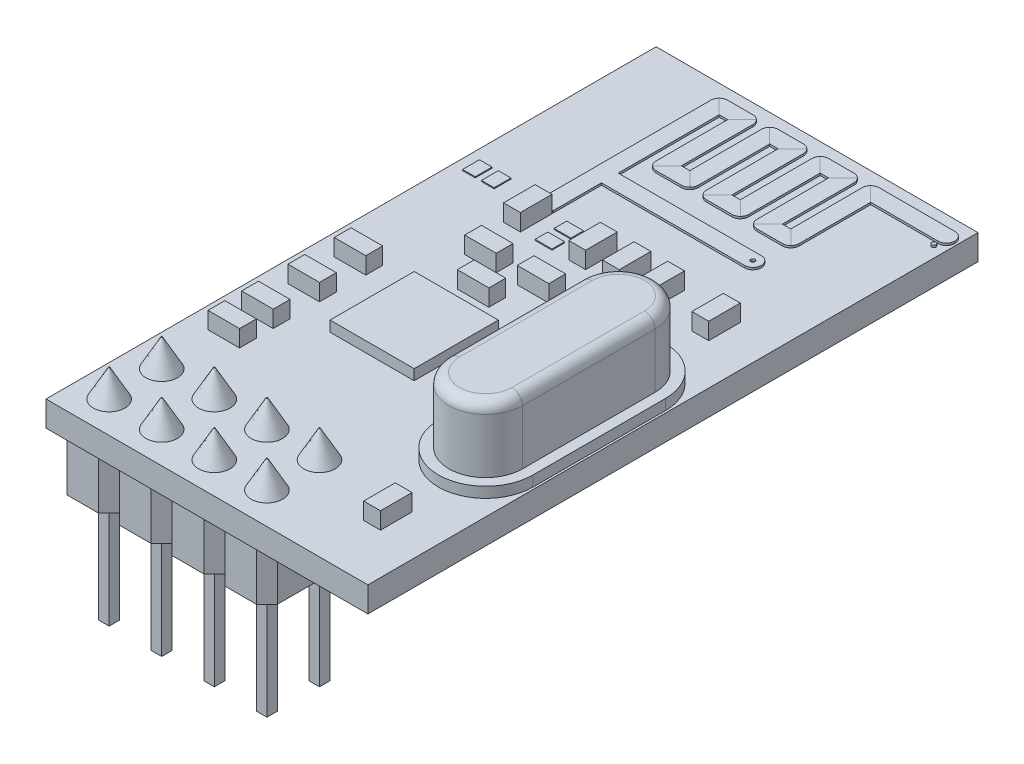
from build123d import *
from OCP.BRepFilletAPI import BRepFilletAPI_MakeChamfer

# Parameters (mm, degrees)
SKETCH_1_W                           = 15.3
SKETCH_1_H                           = 29
EXTRUDE_1_DEPTH                      = 1.2
SKETCH_2_R                           = 0.75
EXTRUDE_2_DEPTH                      = 1.3
CHAMFER_1_SIZE2                      = 0.720601767
CHAMFER_1_SIZE                       = 1.3
PATTERN_LINEAR_1_COUNT               = 4
PATTERN_LINEAR_1_PITCH               = 2.5
PATTERN_LINEAR_1_COUNT_DIR2          = 2
PATTERN_LINEAR_1_PITCH_DIR2          = 2.5
CHAMFER_1_OF_PATTERN_LINEAR_1_SIZE   = 1.3
CHAMFER_1_OF_PATTERN_LINEAR_1_SIZE_2 = 0.720601767
SKETCH_4_W                           = 0.8
SKETCH_4_H                           = 0.2
FILLET_1_R                           = 0.4
EXTRUDE_3_DEPTH                      = 0.1
SKETCH_7_R                           = 0.1
EXTRUDE_4_DEPTH                      = 0.1
SKETCH_8_R                           = 0.1
CUT_EXTRUDE_1_DEPTH                  = 0.1
EXTRUDE_5_DEPTH                      = 3.6
EXTRUDE_6_DEPTH                      = 0.5
FILLET_2_R                           = 0.5
SKETCH_11_W                          = 4
SKETCH_11_H                          = 4
EXTRUDE_7_DEPTH                      = 0.5
SKETCH_12_W                          = 1.5
SKETCH_12_H                          = 0.8
SKETCH_12_W_2                        = 0.8
SKETCH_12_H_2                        = 1.5
EXTRUDE_8_DEPTH                      = 0.8
SKETCH_13_W                          = 0.8
SKETCH_13_H                          = 0.6
SKETCH_13_W_2                        = 0.6
SKETCH_13_H_2                        = 0.8
EXTRUDE_9_DEPTH                      = 0.05
EXTRUDE_10_DEPTH                     = 2.5
SKETCH_15_W                          = 0.5
SKETCH_15_H                          = 0.5
EXTRUDE_11_DEPTH                     = 5.5
CHAMFER_2_SIZE                       = 0.1
PATTERN_LINEAR_2_COUNT               = 4
PATTERN_LINEAR_2_PITCH               = 2.5
PATTERN_LINEAR_3_COUNT               = 4
PATTERN_LINEAR_3_PITCH               = 2.5
CHAMFER_2_OF_PATTERN_LINEAR_3_SIZE   = 0.1
SKETCH_16_R                          = 0.75
EXTRUDE_12_DEPTH                     = 1.3
CHAMFER_3_SIZE                       = 1.3
CHAMFER_3_SIZE_2                     = 0.720601767


with BuildPart() as part:
    # 스케치1 → 보스-돌출1 (new body)
    with BuildSketch(Plane(origin=(0, 0, 0), x_dir=(1, 0, 0), z_dir=(0, 1, 0))):
        Rectangle(SKETCH_1_W, SKETCH_1_H)
    extrude(amount=EXTRUDE_1_DEPTH)

    # 스케치2 → 보스-돌출2 (add)
    with BuildSketch(Plane(origin=(0, 1.2, 0), x_dir=(1, 0, 0), z_dir=(0, 1, 0))):
        with Locations(Location((-6.15, -13, 0), (0, 0, 270))):
            Circle(SKETCH_2_R)
    extrude_2 = extrude(amount=EXTRUDE_2_DEPTH)

    # 모따기1
    chamfer_1_edges = [part.edges().sort_by_distance(p)[0] for p in [
        (-6.15, 2.5, 12.25),
    ]]
    chamfer_1_side = [part.faces().sort_by_distance(p)[0] for p in [
        (-6.15, 2.485587965, 12.25),
    ]]
    chamfer(chamfer_1_edges, length=CHAMFER_1_SIZE - 0.0001, length2=CHAMFER_1_SIZE2 - 0.0001, reference=chamfer_1_side[0])  # a hair under: the kernel refuses the full size

    # 선형 패턴1: Extrude 2 4 × 2
    with Locations(*[(i * PATTERN_LINEAR_1_PITCH, 0, -j * PATTERN_LINEAR_1_PITCH_DIR2) for i in range(PATTERN_LINEAR_1_COUNT) for j in range(PATTERN_LINEAR_1_COUNT_DIR2) if (i, j) != (0, 0)]):
        add(extrude_2)

    # 모따기1 of 선형 패턴1
    chamfer_1_of_pattern_linear_1_edges_1 = [part.edges().sort_by_distance(p)[0] for p in [
        (-6.15, 2.5, 9.75),
    ]]
    chamfer_1_of_pattern_linear_1_side_1 = [part.faces().sort_by_distance(p)[0] for p in [
        (-6.15, 2.485587965, 9.75),
    ]]
    chamfer_1_of_pattern_linear_1_edges_2 = [part.edges().sort_by_distance(p)[0] for p in [
        (-3.65, 2.5, 12.25),
    ]]
    chamfer_1_of_pattern_linear_1_side_2 = [part.faces().sort_by_distance(p)[0] for p in [
        (-3.65, 2.485587965, 12.25),
    ]]
    chamfer_1_of_pattern_linear_1_edges_3 = [part.edges().sort_by_distance(p)[0] for p in [
        (-3.65, 2.5, 9.75),
    ]]
    chamfer_1_of_pattern_linear_1_side_3 = [part.faces().sort_by_distance(p)[0] for p in [
        (-3.65, 2.485587965, 9.75),
    ]]
    chamfer_1_of_pattern_linear_1_edges_4 = [part.edges().sort_by_distance(p)[0] for p in [
        (-1.15, 2.5, 12.25),
    ]]
    chamfer_1_of_pattern_linear_1_side_4 = [part.faces().sort_by_distance(p)[0] for p in [
        (-1.15, 2.485587965, 12.25),
    ]]
    chamfer_1_of_pattern_linear_1_edges_5 = [part.edges().sort_by_distance(p)[0] for p in [
        (-1.15, 2.5, 9.75),
    ]]
    chamfer_1_of_pattern_linear_1_side_5 = [part.faces().sort_by_distance(p)[0] for p in [
        (-1.15, 2.485587965, 9.75),
    ]]
    chamfer_1_of_pattern_linear_1_edges_6 = [part.edges().sort_by_distance(p)[0] for p in [
        (1.35, 2.5, 12.25),
    ]]
    chamfer_1_of_pattern_linear_1_side_6 = [part.faces().sort_by_distance(p)[0] for p in [
        (1.35, 2.485587965, 12.25),
    ]]
    chamfer_1_of_pattern_linear_1_edges_7 = [part.edges().sort_by_distance(p)[0] for p in [
        (1.35, 2.5, 9.75),
    ]]
    chamfer_1_of_pattern_linear_1_side_7 = [part.faces().sort_by_distance(p)[0] for p in [
        (1.35, 2.485587965, 9.75),
    ]]
    chamfer_1_of_pattern_linear_1 = BRepFilletAPI_MakeChamfer(part.part.solid().wrapped)
    for e in chamfer_1_of_pattern_linear_1_edges_1:
        chamfer_1_of_pattern_linear_1.Add(CHAMFER_1_OF_PATTERN_LINEAR_1_SIZE - 0.0001, CHAMFER_1_OF_PATTERN_LINEAR_1_SIZE_2 - 0.0001, e.wrapped, chamfer_1_of_pattern_linear_1_side_1[0].wrapped)
    for e in chamfer_1_of_pattern_linear_1_edges_2:
        chamfer_1_of_pattern_linear_1.Add(CHAMFER_1_OF_PATTERN_LINEAR_1_SIZE - 0.0001, CHAMFER_1_OF_PATTERN_LINEAR_1_SIZE_2 - 0.0001, e.wrapped, chamfer_1_of_pattern_linear_1_side_2[0].wrapped)
    for e in chamfer_1_of_pattern_linear_1_edges_3:
        chamfer_1_of_pattern_linear_1.Add(CHAMFER_1_OF_PATTERN_LINEAR_1_SIZE - 0.0001, CHAMFER_1_OF_PATTERN_LINEAR_1_SIZE_2 - 0.0001, e.wrapped, chamfer_1_of_pattern_linear_1_side_3[0].wrapped)
    for e in chamfer_1_of_pattern_linear_1_edges_4:
        chamfer_1_of_pattern_linear_1.Add(CHAMFER_1_OF_PATTERN_LINEAR_1_SIZE - 0.0001, CHAMFER_1_OF_PATTERN_LINEAR_1_SIZE_2 - 0.0001, e.wrapped, chamfer_1_of_pattern_linear_1_side_4[0].wrapped)
    for e in chamfer_1_of_pattern_linear_1_edges_5:
        chamfer_1_of_pattern_linear_1.Add(CHAMFER_1_OF_PATTERN_LINEAR_1_SIZE - 0.0001, CHAMFER_1_OF_PATTERN_LINEAR_1_SIZE_2 - 0.0001, e.wrapped, chamfer_1_of_pattern_linear_1_side_5[0].wrapped)
    for e in chamfer_1_of_pattern_linear_1_edges_6:
        chamfer_1_of_pattern_linear_1.Add(CHAMFER_1_OF_PATTERN_LINEAR_1_SIZE - 0.0001, CHAMFER_1_OF_PATTERN_LINEAR_1_SIZE_2 - 0.0001, e.wrapped, chamfer_1_of_pattern_linear_1_side_6[0].wrapped)
    for e in chamfer_1_of_pattern_linear_1_edges_7:
        chamfer_1_of_pattern_linear_1.Add(CHAMFER_1_OF_PATTERN_LINEAR_1_SIZE - 0.0001, CHAMFER_1_OF_PATTERN_LINEAR_1_SIZE_2 - 0.0001, e.wrapped, chamfer_1_of_pattern_linear_1_side_7[0].wrapped)
    add(Compound.cast(chamfer_1_of_pattern_linear_1.Shape()), mode=Mode.REPLACE)  # a hair under: the kernel refuses the full size

    # 스윕1: sweep along a path in 스케치3
    with BuildLine(Plane(origin=(0, 1.2, 0), x_dir=(1, 0, 0), z_dir=(0, 1, 0))) as sweep_1_path:
        Line((-3.65, 5.2), (-3.65, 13.5))
        Line((-3.65, 13.5), (-2.45, 13.5))
        Line((-2.45, 13.5), (-2.45, 9.7))
        Line((-2.45, 9.7), (-1.25, 9.7))
        Line((-1.25, 9.7), (-1.25, 13.5))
        Line((-1.25, 13.5), (-0.05, 13.5))
        Line((-0.05, 13.5), (-0.05, 9.7))
        Line((-0.05, 9.7), (1.15, 9.7))
        Line((1.15, 9.7), (1.15, 13.5))
        Line((1.15, 13.5), (2.35, 13.5))
        Line((2.35, 13.5), (2.35, 9.7))
        Line((2.35, 9.7), (3.55, 9.7))
        Line((3.55, 9.7), (3.55, 13.5))
        Line((3.55, 13.5), (7.55, 13.5))
    # 스케치4 → 스윕1 (sweep)
    with BuildSketch(Plane(origin=(7.55, 0, 0), x_dir=(0, 0, -1), z_dir=(1, 0, 0))):
        with Locations((13.5, 1.2)):
            Rectangle(SKETCH_4_W, SKETCH_4_H)
    sweep(path=sweep_1_path.line, transition=Transition.RIGHT)

    # 필렛1
    fillet_1_edges = [part.edges().sort_by_distance(p)[0] for p in [
        (2.75, 1.25, -13.9),
        (0.75, 1.25, -13.9),
        (0.35, 1.25, -13.9),
        (-1.65, 1.25, -13.9),
        (-2.05, 1.25, -13.9),
        (-4.05, 1.25, -13.9),
        (-2.85, 1.25, -9.3),
        (-0.85, 1.25, -9.3),
        (-0.45, 1.25, -9.3),
        (1.55, 1.25, -9.3),
        (1.95, 1.25, -9.3),
        (3.95, 1.25, -9.3),
        (3.15, 1.25, -13.9),
        (7.55, 1.25, -13.1),
        (7.55, 1.25, -13.9),
    ]]
    fillet(fillet_1_edges, radius=FILLET_1_R - 0.0001)  # a hair under: the kernel refuses the full size

    # 스케치6 → 보스-돌출3 (add)
    with BuildSketch(Plane(origin=(0, 1.2, 0), x_dir=(1, 0, 0), z_dir=(0, 1, 0))):
        with BuildLine():
            Line((-3.25, 8.3), (3.55, 8.3))
            ThreePointArc((3.55, 8.3), (3.95, 7.9), (3.55, 7.5))
            Line((3.55, 7.5), (-3.25, 7.5))
            Line((-3.25, 7.5), (-3.25, 8.3))
        make_face()
    extrude(amount=EXTRUDE_3_DEPTH)

    # 스케치7 → 보스-돌출4 (add)
    with BuildSketch(Plane(origin=(0, 1.2, 0), x_dir=(1, 0, 0), z_dir=(0, 1, 0))):
        with Locations(Location((7.15, 12.9, 0), (0, 0, 270))):
            Circle(SKETCH_7_R)
    extrude(amount=EXTRUDE_4_DEPTH)

    # 스케치8 → 컷-돌출1 (cut)
    with BuildSketch(Plane(origin=(0, 1.3, 0), x_dir=(1, 0, 0), z_dir=(0, 1, 0))):
        with Locations(Location((3.55, 7.9, 0), (0, 0, 270))):
            Circle(SKETCH_8_R)
    extrude(amount=-CUT_EXTRUDE_1_DEPTH, mode=Mode.SUBTRACT)

    # 스케치9 → 보스-돌출5 (add)
    with BuildSketch(Plane(origin=(0, 1.2, 0), x_dir=(1, 0, 0), z_dir=(0, 1, 0))):
        with BuildLine():
            Line((3.55, -0.25), (3.55, -6.55))
            ThreePointArc((3.55, -6.55), (5.3, -8.3), (7.05, -6.55))
            Line((7.05, -6.55), (7.05, -0.25))
            ThreePointArc((7.05, -0.25), (5.3, 1.5), (3.55, -0.25))
        make_face()
    extrude(amount=EXTRUDE_5_DEPTH)

    # 스케치10 → 보스-돌출6 (add)
    with BuildSketch(Plane(origin=(0, 1.2, 0), x_dir=(1, 0, 0), z_dir=(0, 1, 0))):
        with BuildLine():
            Line((3.05, -0.25), (3.05, -6.55))
            ThreePointArc((3.05, -6.55), (5.3, -8.8), (7.55, -6.55))
            Line((7.55, -6.55), (7.55, -0.25))
            ThreePointArc((7.55, -0.25), (5.3, 2), (3.05, -0.25))
        make_face()
    extrude(amount=EXTRUDE_6_DEPTH)

    # 필렛2
    fillet_2_edges = [part.edges().sort_by_distance(p)[0] for p in [
        (5.3, 4.8, -1.5),
        (3.55, 4.8, 3.4),
        (5.3, 4.8, 8.3),
        (7.05, 4.8, 3.4),
    ]]
    fillet(fillet_2_edges, radius=FILLET_2_R)

    # 스케치11 → 보스-돌출7 (add)
    with BuildSketch(Plane(origin=(0, 1.2, 0), x_dir=(1, 0, 0), z_dir=(0, 1, 0))):
        with Locations((-1.65, -3)):
            Rectangle(SKETCH_11_W, SKETCH_11_H)
    extrude(amount=EXTRUDE_7_DEPTH)

    # 스케치12 → 보스-돌출8 (add)
    with BuildSketch(Plane(origin=(0, 1.2, 0), x_dir=(1, 0, 0), z_dir=(0, 1, 0))):
        with Locations((-5.9, -7.4)):
            Rectangle(SKETCH_12_W, SKETCH_12_H)
        with Locations((-5.9, -5.8)):
            Rectangle(SKETCH_12_W, SKETCH_12_H)
        with Locations((-5.9, -3.6)):
            Rectangle(SKETCH_12_W, SKETCH_12_H)
        with Locations((-5.9, -1.4)):
            Rectangle(SKETCH_12_W, SKETCH_12_H)
        with Locations((-1.65, 0.2)):
            Rectangle(SKETCH_12_W, SKETCH_12_H)
        with Locations((-2.9, 1.8)):
            Rectangle(SKETCH_12_W, SKETCH_12_H)
        with Locations((-0.4, 1.8)):
            Rectangle(SKETCH_12_W, SKETCH_12_H)
        with Locations((5.3, 4.4)):
            Rectangle(SKETCH_12_W_2, SKETCH_12_H_2)
        with Locations((2.65, 4.4)):
            Rectangle(SKETCH_12_W_2, SKETCH_12_H_2)
        with Locations((1.05, 4.4)):
            Rectangle(SKETCH_12_W_2, SKETCH_12_H_2)
        with Locations((-0.55, 4.4)):
            Rectangle(SKETCH_12_W_2, SKETCH_12_H_2)
        with Locations((-3.65, 4.4)):
            Rectangle(SKETCH_12_W_2, SKETCH_12_H_2)
        with Locations((5.3, -11.2)):
            Rectangle(SKETCH_12_W_2, SKETCH_12_H_2)
    extrude(amount=EXTRUDE_8_DEPTH)

    # 스케치13 → 보스-돌출9 (add)
    with BuildSketch(Plane(origin=(0, 1.2, 0), x_dir=(1, 0, 0), z_dir=(0, 1, 0))):
        with Locations((-2.15, 4.85)):
            Rectangle(SKETCH_13_W, SKETCH_13_H)
        with Locations((-2.15, 3.95)):
            Rectangle(SKETCH_13_W, SKETCH_13_H)
        with Locations((-5.95, 5.2)):
            Rectangle(SKETCH_13_W_2, SKETCH_13_H_2)
        with Locations((-6.85, 5.2)):
            Rectangle(SKETCH_13_W_2, SKETCH_13_H_2)
    extrude(amount=EXTRUDE_9_DEPTH)

    # 스케치14 → 보스-돌출10 (add)
    with BuildSketch(Plane.XZ):
        Polygon((-6.9, 14.25), (-7.4, 13.75), (-7.4, 9.75), (-6.9, 9.25), (-5.4, 9.25), (-4.9, 9.75), (-4.9, 13.75), (-5.4, 14.25), align=None)
    extrude_10 = extrude(amount=EXTRUDE_10_DEPTH)

    # 스케치15 → 보스-돌출11 (add)
    with BuildSketch(Plane.XZ.offset(2.5)):
        with Locations((-6.15, 13)):
            Rectangle(SKETCH_15_W, SKETCH_15_H)
        with Locations((-6.15, 10.5)):
            Rectangle(SKETCH_15_W, SKETCH_15_H)
    extrude_11 = extrude(amount=EXTRUDE_11_DEPTH)

    # 모따기2
    chamfer_2_edges = [part.edges().sort_by_distance(p)[0] for p in [
        (-6.4, -8, 13),
        (-6.15, -8, 12.75),
        (-5.9, -8, 13),
        (-6.15, -8, 13.25),
        (-6.4, -8, 10.5),
        (-6.15, -8, 10.25),
        (-5.9, -8, 10.5),
        (-6.15, -8, 10.75),
    ]]
    chamfer(chamfer_2_edges, length=CHAMFER_2_SIZE)

    # 선형 패턴2: 보스-돌출10 ×4
    with Locations(*[(i * PATTERN_LINEAR_2_PITCH, 0, 0) for i in range(1, PATTERN_LINEAR_2_COUNT)]):
        add(extrude_10)

    # 선형 패턴3: 보스-돌출11 ×4
    with Locations(*[(i * PATTERN_LINEAR_3_PITCH, 0, 0) for i in range(1, PATTERN_LINEAR_3_COUNT)]):
        add(extrude_11)

    # 모따기2 of 선형 패턴3
    chamfer_2_of_pattern_linear_3_edges = [part.edges().sort_by_distance(p)[0] for p in [
        (-3.9, -8, 13),
        (-3.65, -8, 12.75),
        (-3.4, -8, 13),
        (-3.65, -8, 13.25),
        (-3.9, -8, 10.5),
        (-3.65, -8, 10.25),
        (-3.4, -8, 10.5),
        (-3.65, -8, 10.75),
        (-1.4, -8, 13),
        (-1.15, -8, 12.75),
        (-0.9, -8, 13),
        (-1.15, -8, 13.25),
        (-1.4, -8, 10.5),
        (-1.15, -8, 10.25),
        (-0.9, -8, 10.5),
        (-1.15, -8, 10.75),
        (1.1, -8, 13),
        (1.35, -8, 12.75),
        (1.6, -8, 13),
        (1.35, -8, 13.25),
        (1.1, -8, 10.5),
        (1.35, -8, 10.25),
        (1.6, -8, 10.5),
        (1.35, -8, 10.75),
    ]]
    chamfer(chamfer_2_of_pattern_linear_3_edges, length=CHAMFER_2_OF_PATTERN_LINEAR_3_SIZE)

    # 스케치16 → 보스-돌출12 (add)
    with BuildSketch(Plane.XZ):
        with Locations(Location((5.3, 6.55, 0), (0, 0, 90))):
            Circle(SKETCH_16_R)
        with Locations(Location((5.3, 0.25, 0), (0, 0, 90))):
            Circle(SKETCH_16_R)
    extrude(amount=EXTRUDE_12_DEPTH)

    # 모따기3
    chamfer_3_edges_1 = [part.edges().sort_by_distance(p)[0] for p in [
        (5.3, -1.3, 5.8),
    ]]
    chamfer_3_side_1 = [part.faces().sort_by_distance(p)[0] for p in [
        (5.3, -1.285587965, 5.8),
    ]]
    chamfer_3_edges_2 = [part.edges().sort_by_distance(p)[0] for p in [
        (5.3, -1.3, -0.5),
    ]]
    chamfer_3_side_2 = [part.faces().sort_by_distance(p)[0] for p in [
        (5.3, -1.285587965, -0.5),
    ]]
    chamfer_3 = BRepFilletAPI_MakeChamfer(part.part.solid().wrapped)
    for e in chamfer_3_edges_1:
        chamfer_3.Add(CHAMFER_3_SIZE - 0.0001, CHAMFER_3_SIZE_2 - 0.0001, e.wrapped, chamfer_3_side_1[0].wrapped)
    for e in chamfer_3_edges_2:
        chamfer_3.Add(CHAMFER_3_SIZE - 0.0001, CHAMFER_3_SIZE_2 - 0.0001, e.wrapped, chamfer_3_side_2[0].wrapped)
    add(Compound.cast(chamfer_3.Shape()), mode=Mode.REPLACE)  # a hair under: the kernel refuses the full size


solid = part.part
